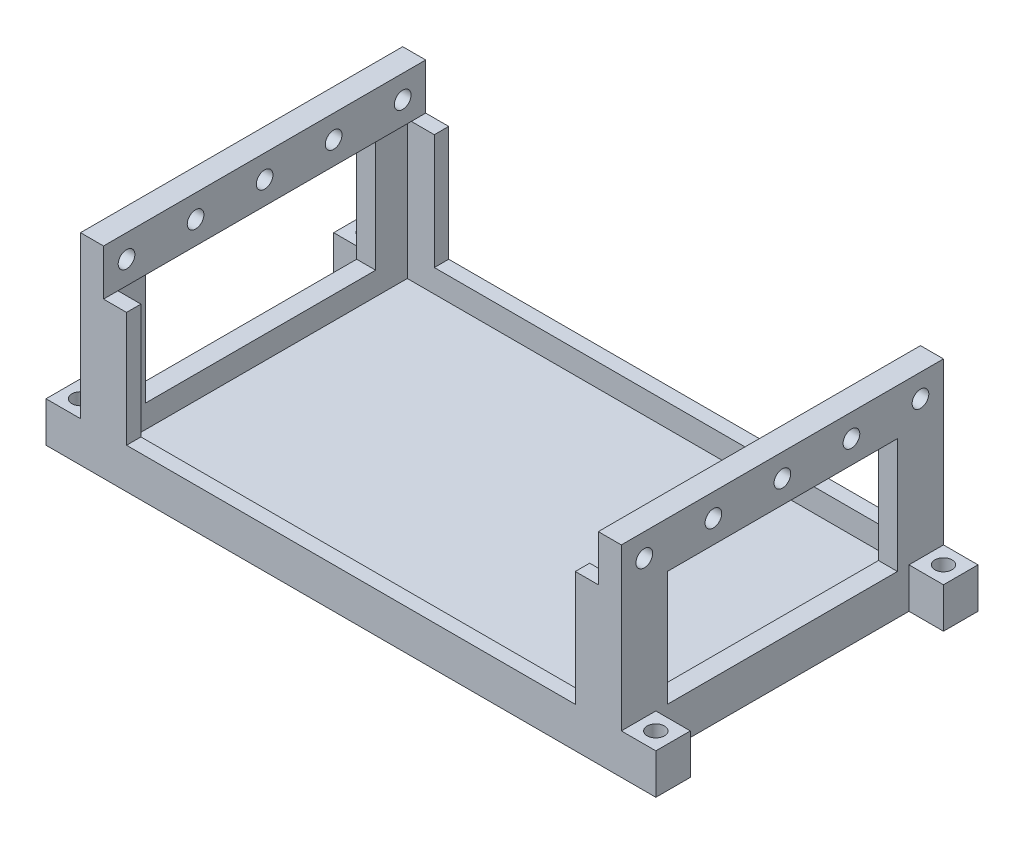
from build123d import *

# Parameters (mm, degrees)
SKETCH1_R           = 1.5
BOSS_EXTRUDE1_DEPTH = 3
SKETCH2_R           = 1.5
SKETCH2_W           = 87.4
SKETCH2_H           = 51
BOSS_EXTRUDE2_DEPTH = 4
BOSS_EXTRUDE3_DEPTH = 20
SKETCH4_W           = 4
SKETCH4_H           = 56
BOSS_EXTRUDE4_DEPTH = 8
SKETCH5_R           = 1.45
CUT_EXTRUDE1_DEPTH  = 120.837389825


with BuildPart() as part:
    # Sketch1 → Boss-Extrude1 (new body)
    with BuildSketch(Plane(origin=(0, 0, 0), x_dir=(1, 0, 0), z_dir=(0, 1, 0))):
        Polygon((0, 0), (94, 0), (100, 0), (100, 6), (94, 6), (94, 50), (100, 50), (100, 56), (94, 56), (0, 56), (-6, 56), (-6, 50), (0, 50), (0, 6), (-6, 6), (-6, 0), align=None)
        with Locations((-3, 53)):
            Circle(SKETCH1_R, mode=Mode.SUBTRACT)
        with Locations((97, 53)):
            Circle(SKETCH1_R, mode=Mode.SUBTRACT)
        with Locations((97, 3)):
            Circle(SKETCH1_R, mode=Mode.SUBTRACT)
        with Locations((-3, 3)):
            Circle(SKETCH1_R, mode=Mode.SUBTRACT)
    extrude(amount=BOSS_EXTRUDE1_DEPTH)

    # Sketch2 → Boss-Extrude2 (add)
    with BuildSketch(Plane(origin=(0, 3, 0), x_dir=(1, 0, 0), z_dir=(0, 1, 0))):
        Polygon((0, 50), (0, 6), (-6, 6), (-6, 0), (100, 0), (100, 6), (94, 6), (94, 50), (100, 50), (100, 56), (-6, 56), (-6, 50), align=None)
        with Locations((-3, 53)):
            Circle(SKETCH2_R, mode=Mode.SUBTRACT)
        with Locations((97, 53)):
            Circle(SKETCH2_R, mode=Mode.SUBTRACT)
        with Locations((97, 3)):
            Circle(SKETCH2_R, mode=Mode.SUBTRACT)
        with Locations((-3, 3)):
            Circle(SKETCH2_R, mode=Mode.SUBTRACT)
        with Locations((47, 28)):
            Rectangle(SKETCH2_W, SKETCH2_H, mode=Mode.SUBTRACT)
    extrude(amount=BOSS_EXTRUDE2_DEPTH)

    # Sketch3 → Boss-Extrude3 (add)
    with BuildSketch(Plane(origin=(0, 7, 0), x_dir=(1, 0, 0), z_dir=(0, 1, 0))):
        Polygon((8, 56), (0, 56), (0, 48), (3.3, 48), (3.3, 53.5), (8, 53.5), align=None)
        Polygon((94, 56), (86, 56), (86, 53.5), (90.7, 53.5), (90.7, 48), (94, 48), align=None)
        Polygon((3.3, 2.5), (3.3, 8), (0, 8), (0, 0), (8, 0), (8, 2.5), align=None)
        Polygon((94, 8), (90.7, 8), (90.7, 2.5), (86, 2.5), (86, 0), (94, 0), align=None)
    extrude(amount=BOSS_EXTRUDE3_DEPTH)

    # Sketch4 → Boss-Extrude4 (add)
    with BuildSketch(Plane(origin=(0, 27, 0), x_dir=(1, 0, 0), z_dir=(0, 1, 0))):
        with Locations((2, 28)):
            Rectangle(SKETCH4_W, SKETCH4_H)
        with Locations((92, 28)):
            Rectangle(SKETCH4_W, SKETCH4_H)
    extrude(amount=BOSS_EXTRUDE4_DEPTH)

    # Sketch5 → Cut-Extrude1 (cut, through all)
    with BuildSketch(Plane.ZY):
        with Locations((-52, 31)):
            Circle(SKETCH5_R)
        with Locations((-40, 31)):
            Circle(SKETCH5_R)
        with Locations((-28, 31)):
            Circle(SKETCH5_R)
        with Locations((-16, 31)):
            Circle(SKETCH5_R)
        with Locations((-4, 31)):
            Circle(SKETCH5_R)
    extrude(amount=-CUT_EXTRUDE1_DEPTH, mode=Mode.SUBTRACT)


solid = part.part
